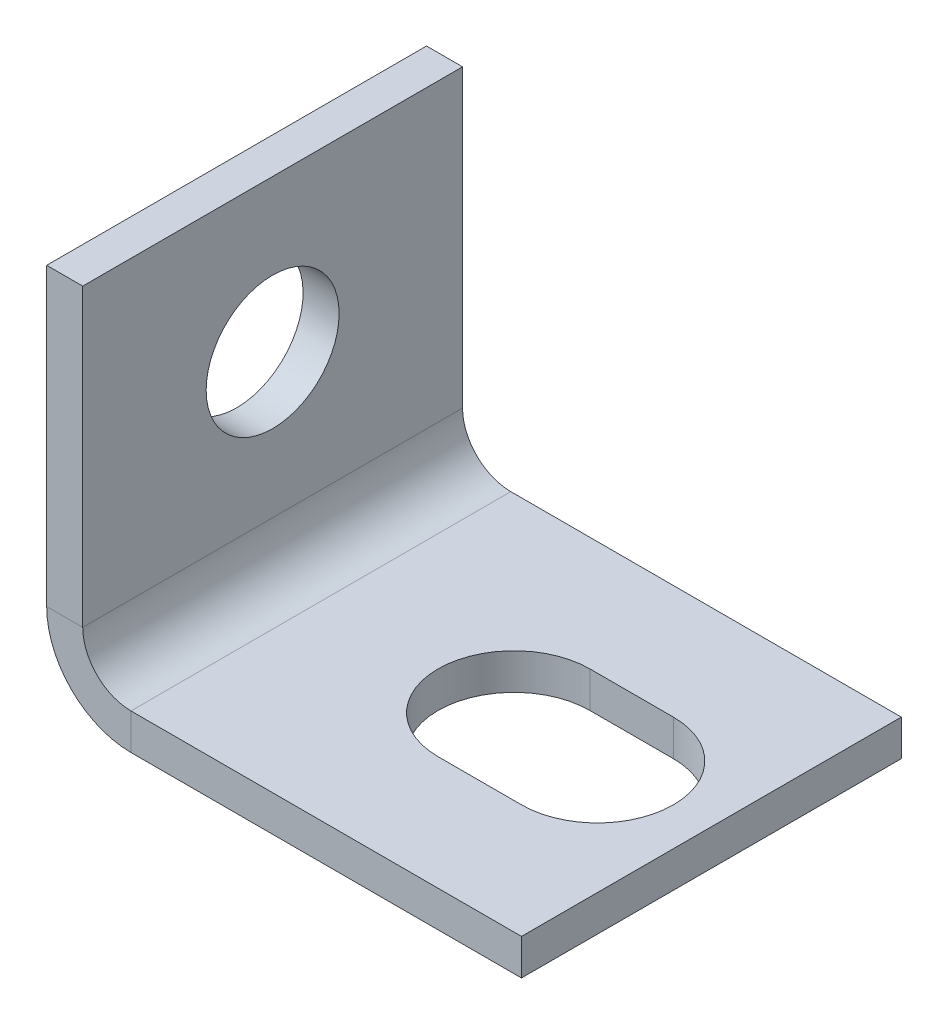
from build123d import *

# Parameters (mm, degrees)
SKETCH2_W                    = 25
SKETCH2_H                    = 20
BASE_FLANGE1_DEPTH           = 1.89738
EDGE_FLANGE1_STRIP_W         = 12.66952
EDGE_FLANGE1_STRIP_H         = 1.89738
EDGE_FLANGE1_STRIP_CUT_DEPTH = 20
EDGE_FLANGE1_DEPTH           = 20
SKETCH11_R                   = 3.5
CUT_EXTRUDE1_DEPTH           = 10
CUT_EXTRUDE2_DEPTH           = 10


# Sheet-metal steps are written as plain solids
with BuildPart() as part:
    # Sketch2 → Base-Flange1 (new body)
    with BuildSketch(Plane(origin=(0, 3.26937922, 0), x_dir=(1, 0, 0), z_dir=(0, 1, 0))):
        with Locations((-25.783324161, -391.136685208)):
            Rectangle(SKETCH2_W, SKETCH2_H)
    extrude(amount=BASE_FLANGE1_DEPTH)

    # Edge-Flange1 strip (across the edge) → Edge-Flange1 strip cut (cut)
    with BuildSketch(Plane(origin=(-38.283324161, 5.16675922, 381.136685208), x_dir=(1, 0, 0), z_dir=(0, 0, 1))):
        with Locations((-1.89738, -0.94869)):
            Rectangle(EDGE_FLANGE1_STRIP_W, EDGE_FLANGE1_STRIP_H)
    extrude(amount=EDGE_FLANGE1_STRIP_CUT_DEPTH, mode=Mode.SUBTRACT)

    # Edge-Flange1 section (across the edge) → Edge-Flange1 (add)
    with BuildSketch(Plane(origin=(-38.283324161, 5.16675922, 381.136685208), x_dir=(1, 0, 0), z_dir=(0, 0, 1))):
        with BuildLine():
            Line((0, 2.54), (0, 18.10262))
            Line((0, 18.10262), (1.89738, 18.10262))
            Line((1.89738, 18.10262), (1.89738, 2.54))
            ThreePointArc((1.89738, 2.54), (2.641328776, 0.743948776), (4.43738, 0))
            Line((4.43738, 0), (4.43738, -1.89738))
            ThreePointArc((4.43738, -1.89738), (1.299678511, -0.597701489), (0, 2.54))
        make_face()
    extrude(amount=EDGE_FLANGE1_DEPTH)

    # Sketch11 → Cut-Extrude1 (cut)
    with BuildSketch(Plane.ZY.offset(38.283324161)):
        with Locations(Location((391.136685208, 15.26937922, 0), (0, 0, 270))):
            Circle(SKETCH11_R)
    extrude(amount=-CUT_EXTRUDE1_DEPTH, mode=Mode.SUBTRACT)

    # Sketch13 → Cut-Extrude2 (cut)
    with BuildSketch(Plane(origin=(0, 5.16675922, 0), x_dir=(1, 0, 0), z_dir=(0, 1, 0))):
        with BuildLine():
            Line((-23.678800395, -387.136685208), (-19.283324161, -387.136685208))
            ThreePointArc((-19.283324161, -387.136685208), (-15.283324161, -391.136685208), (-19.283324161, -395.136685208))
            Line((-19.283324161, -395.136685208), (-23.678800395, -395.136685208))
            ThreePointArc((-23.678800395, -395.136685208), (-27.678800395, -391.136685208), (-23.678800395, -387.136685208))
        make_face()
    extrude(amount=-CUT_EXTRUDE2_DEPTH, mode=Mode.SUBTRACT)


solid = part.part
